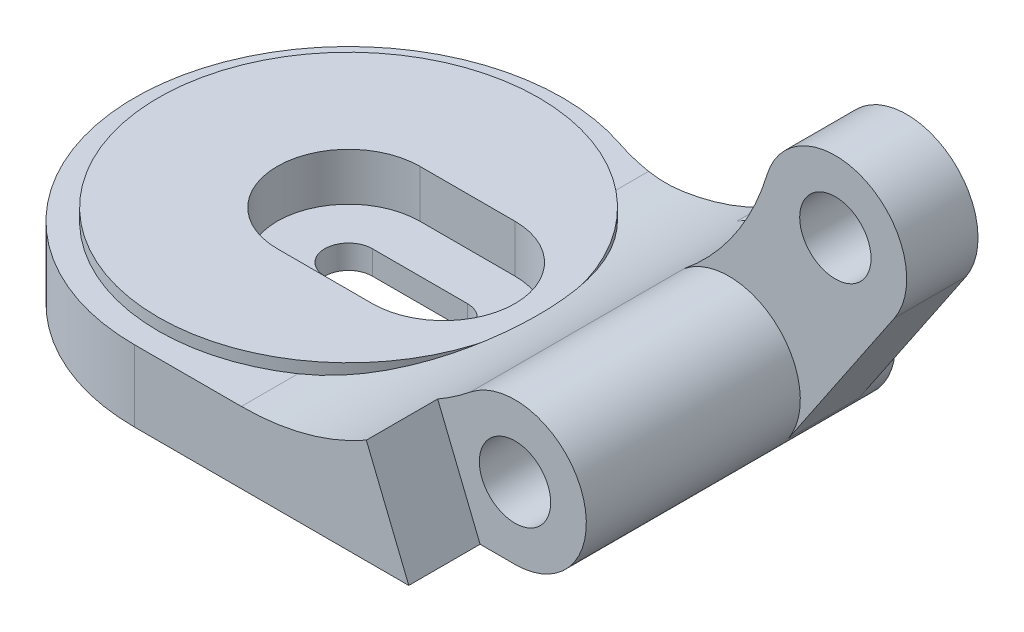
from build123d import *

# Parameters (mm, degrees)
SKETCH1_R           = 9
BOSS_EXTRUDE1_DEPTH = 3
SKETCH2_W           = 4.492348724
SKETCH2_H           = 3
BOSS_EXTRUDE2_DEPTH = 9
CUT_EXTRUDE1_DEPTH  = 8
BOSS_EXTRUDE6_START = -6
BOSS_EXTRUDE6_DEPTH = 3
FILLET1_R           = 10
SKETCH4_R           = 3
CUT_EXTRUDE2_DEPTH  = 1
SKETCH5_R           = 8
CUT_EXTRUDE3_DEPTH  = 2.5
SKETCH6_R           = 6
CUT_EXTRUDE4_DEPTH  = 2.5
CUT_EXTRUDE5_DEPTH  = 3
HOLE1_START         = -7
HOLE1_OUTLINE_R     = 1.5
HOLE1_DEPTH         = 13
SKETCH13_W          = 1.5
SKETCH13_H          = 15
SKETCH14_R          = 8
BOSS_EXTRUDE5_DEPTH = 3
CUT_EXTRUDE6_DEPTH  = 2
CUT_EXTRUDE7_DEPTH  = 2
FILLET5_R           = 0.5


with BuildPart() as part:
    # Sketch1 → Boss-Extrude1 (new body)
    with BuildSketch(Plane(origin=(0, 0, 0), x_dir=(1, 0, 0), z_dir=(0, 1, 0))):
        with Locations(Location((0, 0, 0), (0, 0, 270))):
            Circle(SKETCH1_R)
    extrude(amount=BOSS_EXTRUDE1_DEPTH)

    # Sketch2 → Boss-Extrude2 (add, symmetric)
    with BuildSketch(Plane.XY):
        with BuildLine():
            ThreePointArc((11.118241852, 5.336447362), (8.005233793, 3.601221323), (4.492348724, 3))
            Line((4.492348724, 3), (4.492348724, 0))
            Line((4.492348724, 0), (13, 0))
            ThreePointArc((13, 0), (10.170747264, 2.002338255), (11.118241852, 5.336447362))
        make_face()
        with BuildLine():
            ThreePointArc((16, 3), (14.29513041, 5.70603718), (11.118241852, 5.336447362))
            ThreePointArc((11.118241852, 5.336447362), (10.170747264, 2.002338255), (13, 0))
            ThreePointArc((13, 0), (14.408414688, 0.351157221), (15.487112718, 1.32242129))
            ThreePointArc((15.487112718, 1.32242129), (15.868914268, 2.122884886), (16, 3))
        make_face()
        with Locations((2.246174362, 1.5)):
            Rectangle(SKETCH2_W, SKETCH2_H)
    extrude(amount=BOSS_EXTRUDE2_DEPTH, both=True)

    # Sketch3 → Cut-Extrude1 (cut, symmetric)
    with BuildSketch(Plane(origin=(0, 3, 0), x_dir=(1, 0, 0), z_dir=(0, 1, 0))):
        with BuildLine():
            ThreePointArc((0, 9), (2.121320344, 8.746427842), (4.123105626, 8))
            Line((4.123105626, 8), (20.22341573, 8))
            Line((20.22341573, 8), (20.22341573, 9))
            Line((20.22341573, 9), (0, 9))
        make_face()
    extrude(amount=CUT_EXTRUDE1_DEPTH, both=True, mode=Mode.SUBTRACT)

    # Sketch2<3> → Boss-Extrude6 (add)
    with BuildSketch(Plane.XY.offset(BOSS_EXTRUDE6_START)):
        with BuildLine():
            ThreePointArc((14.602307947, 10.501787764), (13.249766942, 7.656401863), (11.118241852, 5.336447362))
            ThreePointArc((11.118241852, 5.336447362), (15.029708074, 5.20913674), (15.487112718, 1.32242129))
            Line((15.487112718, 1.32242129), (19.960655945, 7.95472187))
            ThreePointArc((19.960655945, 7.95472187), (18.761477117, 12.341770325), (14.602307947, 10.501787764))
        make_face()
    extrude(amount=BOSS_EXTRUDE6_DEPTH)

    # Fillet1
    fillet1_edges = [part.edges().sort_by_distance(p)[0] for p in [
        (4.123105626, 1.5, -8),
    ]]
    fillet(fillet1_edges, radius=FILLET1_R)

    # Sketch4 → Cut-Extrude2 (cut, symmetric)
    with BuildSketch(Plane.XY.offset(-8)):
        with Locations((13, 3)):
            Circle(SKETCH4_R)
    extrude(amount=CUT_EXTRUDE2_DEPTH, both=True, mode=Mode.SUBTRACT)

    # Sketch5 → Cut-Extrude3 (cut, symmetric)
    with BuildSketch(Plane(origin=(0, 3, 0), x_dir=(1, 0, 0), z_dir=(0, 1, 0))):
        with Locations(Location((0, 0, 0), (0, 0, 270))):
            Circle(SKETCH5_R)
    extrude(amount=CUT_EXTRUDE3_DEPTH, both=True, mode=Mode.SUBTRACT)

    # Sketch6 → Cut-Extrude4 (cut, symmetric)
    with BuildSketch(Plane(origin=(0, 0.5, 0), x_dir=(1, 0, 0), z_dir=(0, 1, 0))):
        with Locations(Location((0, 0, 0), (0, 0, 270))):
            Circle(SKETCH6_R)
    extrude(amount=CUT_EXTRUDE4_DEPTH, both=True, mode=Mode.SUBTRACT)

    # Sketch7 → Cut-Extrude5 (cut)
    with BuildSketch(Plane(origin=(0, 0, 9), x_dir=(-1, 0, 0), z_dir=(0, 0, -1))):
        with BuildLine():
            Line((-13, 0), (-11.53289423, 0))
            Line((-11.53289423, 0), (-9.747506928, 4.399961457))
            ThreePointArc((-9.747506928, 4.399961457), (-10.451299694, 4.841235284), (-11.118241854, 5.336447363))
            ThreePointArc((-11.118241854, 5.336447363), (-15.829252736, 3.997661744), (-13, 0))
        make_face()
    extrude(amount=CUT_EXTRUDE5_DEPTH, mode=Mode.SUBTRACT)

    # Hole1: read off the stored shape, not the designer's step
    # Hole1 outline → Hole1 (cut)
    with BuildSketch(Plane.XY.offset(HOLE1_START)):
        with Locations((13, 3)):
            Circle(HOLE1_OUTLINE_R)
    extrude(amount=HOLE1_DEPTH, mode=Mode.SUBTRACT)

    # Sketch13 → Ø3.0 mm Dowel Holes1 (revolve, cut)
    with BuildSketch(Plane(origin=(17.473543228, 9.63230058, -6), x_dir=(0, 1, 0), z_dir=(1, 0, 0))):
        with Locations((0.75, 7.5)):
            Rectangle(SKETCH13_W, SKETCH13_H)
    revolve(axis=Axis((17.473543228, 9.63230058, -12.35), (0, 0, 1)), mode=Mode.SUBTRACT)

    # Fillet5
    # the kernel refuses this fillet: 0.5 mm, written as the material it takes off along each edge
    with BuildSketch(Plane(origin=(13, 0, -14.123724357), x_dir=(-1, 0, 0), z_dir=(0, 0, 1))) as fillet5_piece_1:
        with BuildLine():
            CenterArc((2.449489743, -0.5), FILLET5_R, 90, 135.584691403)
            ThreePointArc((2.099562637, -0.857142857), (1.133893419, -0.222539701), (0, 0))
            Line((0, 0), (2.449489743, 0))
        make_face()
    extrude(amount=7.123724357, mode=Mode.SUBTRACT)
    with BuildSketch(Plane(origin=(11.118241852, 5.336447362, -13.280688141), x_dir=(-0.524989604384867, -0.8511086389455936, 0), z_dir=(0, 0, 1))) as fillet5_piece_2:
        with BuildLine():
            CenterArc((2.168111982, -0.471365199), FILLET5_R, 109.484734083, 129.554348195)
            ThreePointArc((1.910885347, -0.900124407), (0.977998077, -0.402179055), (0, 0))
            ThreePointArc((0, 0), (1.000667069, -0.171808808), (2.001334137, 0))
        make_face()
    extrude(amount=6.280688141, mode=Mode.SUBTRACT)


with BuildPart() as body_2:
    # Sketch14 → Boss-Extrude5 (new body)
    with BuildSketch(Plane(origin=(0, 0.5, 0), x_dir=(1, 0, 0), z_dir=(0, 1, 0))):
        with Locations(Location((0, 0, 0), (0, 0, 270))):
            Circle(SKETCH14_R)
    extrude(amount=BOSS_EXTRUDE5_DEPTH)

    # Sketch15 → Cut-Extrude6 (cut)
    with BuildSketch(Plane(origin=(0, 3.5, 0), x_dir=(1, 0, 0), z_dir=(0, 1, 0))):
        with BuildLine():
            Line((0, 3), (4, 3))
            ThreePointArc((4, 3), (7, 0), (4, -3))
            Line((4, -3), (0, -3))
            ThreePointArc((0, -3), (-3, 0), (0, 3))
        make_face()
    extrude(amount=-CUT_EXTRUDE6_DEPTH, mode=Mode.SUBTRACT)

    # Sketch17 → Cut-Extrude7 (cut)
    with BuildSketch(Plane(origin=(0, 1.5, 0), x_dir=(1, 0, 0), z_dir=(0, 1, 0))):
        with BuildLine():
            Line((0, -1), (4, -1))
            ThreePointArc((4, -1), (5, 0), (4, 1))
            Line((4, 1), (0, 1))
            ThreePointArc((0, 1), (-1, 0), (0, -1))
        make_face()
    extrude(amount=-CUT_EXTRUDE7_DEPTH, mode=Mode.SUBTRACT)


solid = Compound([part.part, body_2.part])
